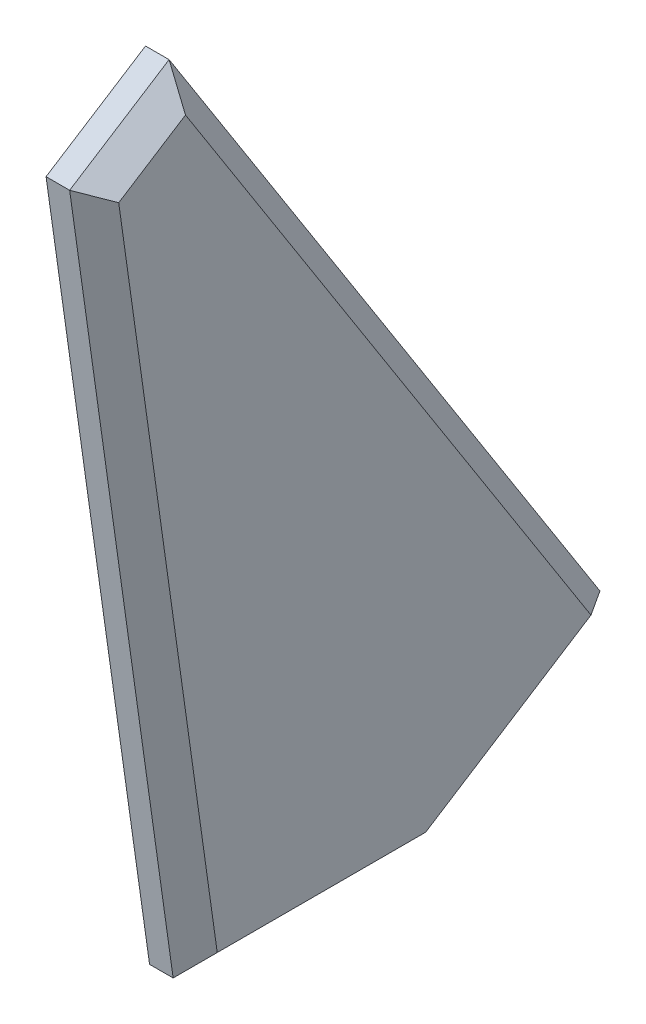
from build123d import *

# Parameters (mm, degrees)
EXTRUDE_1_DEPTH = 5
EXTRUDE_2_DEPTH = 5
CHAMFER_1_SIZE  = 5


with BuildPart() as part:
    # 草图1 → 凸台-拉伸1 (new body)
    with BuildSketch(Plane(origin=(0, 0, 0), x_dir=(0, 0, -1), z_dir=(1, 0, 0))):
        Polygon((0, 0), (-49.989775554, 0), (-71.927055422, 155.560810463), (-50.848590899, 169.003218482), (40.470651885, 25.809423396), align=None)
    extrude(amount=EXTRUDE_1_DEPTH)


with BuildPart() as body_2:
    # 草图2 → 凸台-拉伸2 (new body)
    with BuildSketch(Plane(origin=(5, 0, 0), x_dir=(0, 0, -1), z_dir=(1, 0, 0))):
        Polygon((0, 0), (40.470651885, 25.809423396), (-50.848590899, 169.003218482), (-71.927055422, 155.560810463), (-49.989775554, 0), align=None)
    extrude(amount=EXTRUDE_2_DEPTH)

    # 倒角1
    chamfer_1_edges = [body_2.edges().sort_by_distance(p)[0] for p in [
        (10, 77.780405232, 60.958415488),
        (10, 162.282014473, 61.38782316),
        (10, 97.406320939, 5.188969507),
        (10, 12.904711698, -20.235325942),
        (10, 0, 24.994887777),
    ]]
    chamfer(chamfer_1_edges, length=CHAMFER_1_SIZE - 0.0001)  # a hair under: the kernel refuses the full size


solid = Compound([part.part, body_2.part])
